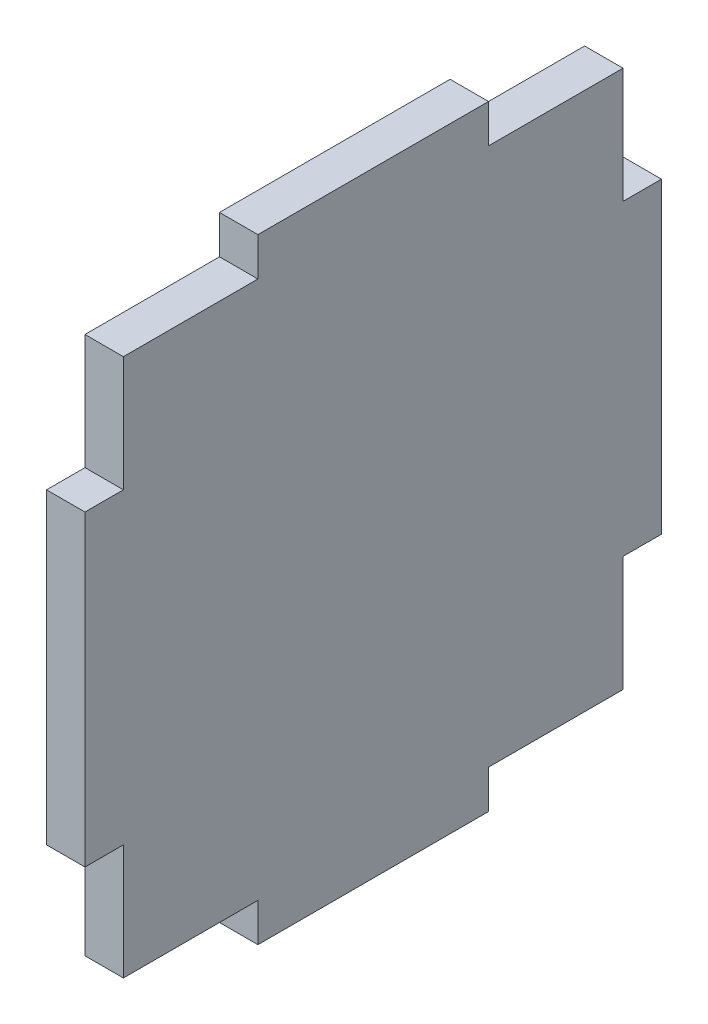
from build123d import *

# Parameters (mm, degrees)
SKETCH1_W                                = 75
SKETCH1_H                                = 80
BOSS_EXTRUDE1_DEPTH                      = 5
CUT_EXTRUDE1_DEPTH                       = 56.056788864
MIRROR1_AT_THE_SECOND_PLANE_COPY_1_DEPTH = 56.056788864


with BuildPart() as part:
    # Sketch1 → Boss-Extrude1 (new body)
    with BuildSketch(Plane(origin=(0, 0, 0), x_dir=(0, 0, -1), z_dir=(1, 0, 0))):
        Rectangle(SKETCH1_W, SKETCH1_H)
    extrude(amount=BOSS_EXTRUDE1_DEPTH)

    # Sketch3 → Cut-Extrude1 (cut, symmetric)
    with BuildSketch(Plane(origin=(5, 0, 0), x_dir=(0, 0, -1), z_dir=(1, 0, 0))):
        Polygon((-37.5, 20), (-32.5, 20), (-32.5, 35), (-15, 35), (-15, 40), (-37.5, 40), align=None)
    cut_extrude1 = extrude(amount=CUT_EXTRUDE1_DEPTH, both=True, mode=Mode.SUBTRACT)

    # Mirror1: Cut-Extrude1 across plane
    add(cut_extrude1.mirror(Plane.XY), mode=Mode.SUBTRACT)

    # Mirror1 at the second plane: Cut-Extrude1 across plane
    add(cut_extrude1.mirror(Plane.ZX), mode=Mode.SUBTRACT)

    # Mirror1 at the second plane copy 1 sketc → Mirror1 at the second plane copy 1 (cut, symmetric)
    with BuildSketch(Plane(origin=(5, 0, 0), x_dir=(0, 0, 1), z_dir=(1, 0, 0))):
        Polygon((-37.5, 20), (-32.5, 20), (-32.5, 35), (-15, 35), (-15, 40), (-37.5, 40), align=None)
    extrude(amount=MIRROR1_AT_THE_SECOND_PLANE_COPY_1_DEPTH, both=True, mode=Mode.SUBTRACT)


solid = part.part
